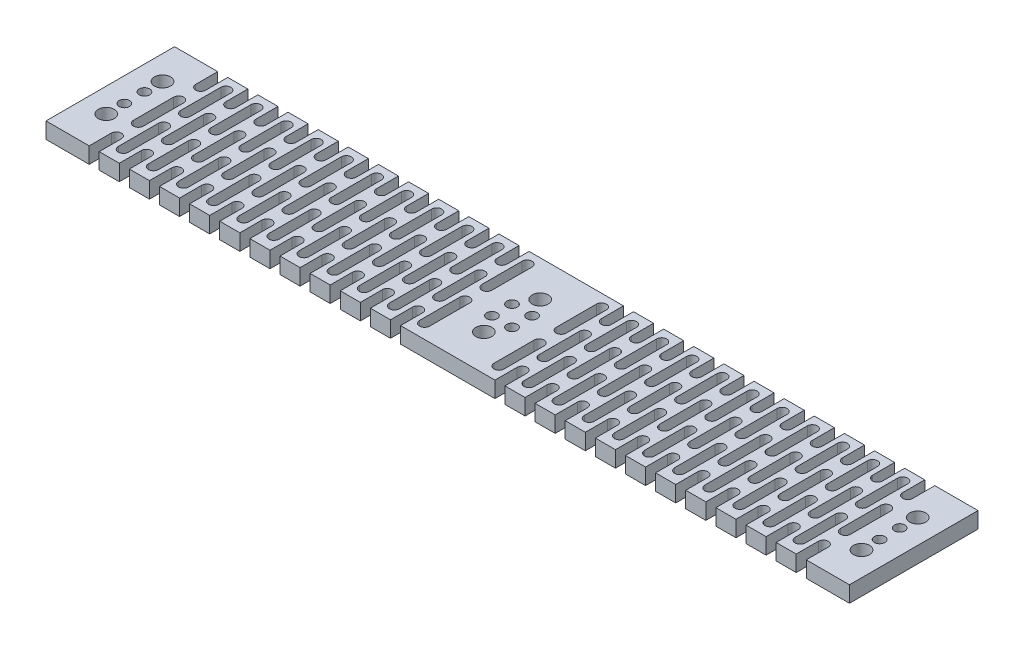
from build123d import *

# Parameters (mm, degrees)
SKETCH_1_W          = 100
SKETCH_1_H          = 16
EXTRUDE_1_DEPTH     = 2
SKETCH_2_R          = 1
SKETCH_2_R_2        = 0.65
CUT_EXTRUDE_1_DEPTH = 51.675437837
CUT_EXTRUDE_2_DEPTH = 51.675437837


with BuildPart() as part:
    # 스케치1 → 보스-돌출1 (new body)
    with BuildSketch(Plane(origin=(0, 0, 0), x_dir=(1, 0, 0), z_dir=(0, 1, 0))):
        Rectangle(SKETCH_1_W, SKETCH_1_H)
    extrude(amount=EXTRUDE_1_DEPTH)

    # 스케치2 → 컷-돌출1 (cut, through all)
    with BuildSketch(Plane(origin=(0, 2, 0), x_dir=(1, 0, 0), z_dir=(0, 1, 0))):
        with Locations((47, 3.5)):
            Circle(SKETCH_2_R)
        with Locations((0, 3.5)):
            Circle(SKETCH_2_R)
        with Locations((-47, 3.5)):
            Circle(SKETCH_2_R)
        with Locations((47, 1.25)):
            Circle(SKETCH_2_R_2)
        with Locations((-47, 1.25)):
            Circle(SKETCH_2_R_2)
        with Locations((1.25, 1.25)):
            Circle(SKETCH_2_R_2)
        with Locations((-1.25, 1.25)):
            Circle(SKETCH_2_R_2)
        with Locations((47, -1.25)):
            Circle(SKETCH_2_R_2)
        with Locations((47, -3.5)):
            Circle(SKETCH_2_R)
        with Locations((-1.25, -1.25)):
            Circle(SKETCH_2_R_2)
        with Locations((1.25, -1.25)):
            Circle(SKETCH_2_R_2)
        with Locations((0, -3.5)):
            Circle(SKETCH_2_R)
        with Locations((-47, -1.25)):
            Circle(SKETCH_2_R_2)
        with Locations((-47, -3.5)):
            Circle(SKETCH_2_R)
    extrude(amount=-CUT_EXTRUDE_1_DEPTH, mode=Mode.SUBTRACT)

    # 스케치3 → 컷-돌출2 (cut, through all)
    with BuildSketch(Plane(origin=(0, 2, 0), x_dir=(1, 0, 0), z_dir=(0, 1, 0))):
        with BuildLine():
            Line((44.625, 2.5), (44.625, -2.5))
            ThreePointArc((44.625, -2.5), (44, -3.125), (43.375, -2.5))
            Line((43.375, -2.5), (43.375, 2.5))
            ThreePointArc((43.375, 2.5), (44, 3.125), (44.625, 2.5))
        make_face()
        with BuildLine():
            Line((40.875, 2.5), (40.875, -2.5))
            ThreePointArc((40.875, -2.5), (40.25, -3.125), (39.625, -2.5))
            Line((39.625, -2.5), (39.625, 2.5))
            ThreePointArc((39.625, 2.5), (40.25, 3.125), (40.875, 2.5))
        make_face()
        with BuildLine():
            Line((37.125, 2.5), (37.125, -2.5))
            ThreePointArc((37.125, -2.5), (36.5, -3.125), (35.875, -2.5))
            Line((35.875, -2.5), (35.875, 2.5))
            ThreePointArc((35.875, 2.5), (36.5, 3.125), (37.125, 2.5))
        make_face()
        with BuildLine():
            Line((33.375, 2.5), (33.375, -2.5))
            ThreePointArc((33.375, -2.5), (32.75, -3.125), (32.125, -2.5))
            Line((32.125, -2.5), (32.125, 2.5))
            ThreePointArc((32.125, 2.5), (32.75, 3.125), (33.375, 2.5))
        make_face()
        with BuildLine():
            Line((29.625, 2.5), (29.625, -2.5))
            ThreePointArc((29.625, -2.5), (29, -3.125), (28.375, -2.5))
            Line((28.375, -2.5), (28.375, 2.5))
            ThreePointArc((28.375, 2.5), (29, 3.125), (29.625, 2.5))
        make_face()
        with BuildLine():
            Line((25.875, 2.5), (25.875, -2.5))
            ThreePointArc((25.875, -2.5), (25.25, -3.125), (24.625, -2.5))
            Line((24.625, -2.5), (24.625, 2.5))
            ThreePointArc((24.625, 2.5), (25.25, 3.125), (25.875, 2.5))
        make_face()
        with BuildLine():
            Line((22.125, 2.5), (22.125, -2.5))
            ThreePointArc((22.125, -2.5), (21.5, -3.125), (20.875, -2.5))
            Line((20.875, -2.5), (20.875, 2.5))
            ThreePointArc((20.875, 2.5), (21.5, 3.125), (22.125, 2.5))
        make_face()
        with BuildLine():
            Line((18.375, 2.5), (18.375, -2.5))
            ThreePointArc((18.375, -2.5), (17.75, -3.125), (17.125, -2.5))
            Line((17.125, -2.5), (17.125, 2.5))
            ThreePointArc((17.125, 2.5), (17.75, 3.125), (18.375, 2.5))
        make_face()
        with BuildLine():
            Line((14.625, 2.5), (14.625, -2.5))
            ThreePointArc((14.625, -2.5), (14, -3.125), (13.375, -2.5))
            Line((13.375, -2.5), (13.375, 2.5))
            ThreePointArc((13.375, 2.5), (14, 3.125), (14.625, 2.5))
        make_face()
        with BuildLine():
            Line((10.875, 2.5), (10.875, -2.5))
            ThreePointArc((10.875, -2.5), (10.25, -3.125), (9.625, -2.5))
            Line((9.625, -2.5), (9.625, 2.5))
            ThreePointArc((9.625, 2.5), (10.25, 3.125), (10.875, 2.5))
        make_face()
        with BuildLine():
            Line((7.125, 2.5), (7.125, -2.5))
            ThreePointArc((7.125, -2.5), (6.5, -3.125), (5.875, -2.5))
            Line((5.875, -2.5), (5.875, 2.5))
            ThreePointArc((5.875, 2.5), (6.5, 3.125), (7.125, 2.5))
        make_face()
        with BuildLine():
            Line((40.875, 10.25), (40.875, 5.25))
            ThreePointArc((40.875, 5.25), (40.25, 4.625), (39.625, 5.25))
            Line((39.625, 5.25), (39.625, 10.25))
            ThreePointArc((39.625, 10.25), (40.25, 10.875), (40.875, 10.25))
        make_face()
        with BuildLine():
            Line((37.125, 10.25), (37.125, 5.25))
            ThreePointArc((37.125, 5.25), (36.5, 4.625), (35.875, 5.25))
            Line((35.875, 5.25), (35.875, 10.25))
            ThreePointArc((35.875, 10.25), (36.5, 10.875), (37.125, 10.25))
        make_face()
        with BuildLine():
            Line((33.375, 10.25), (33.375, 5.25))
            ThreePointArc((33.375, 5.25), (32.75, 4.625), (32.125, 5.25))
            Line((32.125, 5.25), (32.125, 10.25))
            ThreePointArc((32.125, 10.25), (32.75, 10.875), (33.375, 10.25))
        make_face()
        with BuildLine():
            Line((29.625, 10.25), (29.625, 5.25))
            ThreePointArc((29.625, 5.25), (29, 4.625), (28.375, 5.25))
            Line((28.375, 5.25), (28.375, 10.25))
            ThreePointArc((28.375, 10.25), (29, 10.875), (29.625, 10.25))
        make_face()
        with BuildLine():
            Line((25.875, 10.25), (25.875, 5.25))
            ThreePointArc((25.875, 5.25), (25.25, 4.625), (24.625, 5.25))
            Line((24.625, 5.25), (24.625, 10.25))
            ThreePointArc((24.625, 10.25), (25.25, 10.875), (25.875, 10.25))
        make_face()
        with BuildLine():
            Line((22.125, 10.25), (22.125, 5.25))
            ThreePointArc((22.125, 5.25), (21.5, 4.625), (20.875, 5.25))
            Line((20.875, 5.25), (20.875, 10.25))
            ThreePointArc((20.875, 10.25), (21.5, 10.875), (22.125, 10.25))
        make_face()
        with BuildLine():
            Line((18.375, 10.25), (18.375, 5.25))
            ThreePointArc((18.375, 5.25), (17.75, 4.625), (17.125, 5.25))
            Line((17.125, 5.25), (17.125, 10.25))
            ThreePointArc((17.125, 10.25), (17.75, 10.875), (18.375, 10.25))
        make_face()
        with BuildLine():
            Line((14.625, 10.25), (14.625, 5.25))
            ThreePointArc((14.625, 5.25), (14, 4.625), (13.375, 5.25))
            Line((13.375, 5.25), (13.375, 10.25))
            ThreePointArc((13.375, 10.25), (14, 10.875), (14.625, 10.25))
        make_face()
        with BuildLine():
            Line((10.875, 10.25), (10.875, 5.25))
            ThreePointArc((10.875, 5.25), (10.25, 4.625), (9.625, 5.25))
            Line((9.625, 5.25), (9.625, 10.25))
            ThreePointArc((9.625, 10.25), (10.25, 10.875), (10.875, 10.25))
        make_face()
        with BuildLine():
            Line((7.125, 10.25), (7.125, 5.25))
            ThreePointArc((7.125, 5.25), (6.5, 4.625), (5.875, 5.25))
            Line((5.875, 5.25), (5.875, 10.25))
            ThreePointArc((5.875, 10.25), (6.5, 10.875), (7.125, 10.25))
        make_face()
        with BuildLine():
            Line((44.625, 10.25), (44.625, 5.25))
            ThreePointArc((44.625, 5.25), (44, 4.625), (43.375, 5.25))
            Line((43.375, 5.25), (43.375, 10.25))
            ThreePointArc((43.375, 10.25), (44, 10.875), (44.625, 10.25))
        make_face()
        with BuildLine():
            Line((44.625, -10.25), (44.625, -5.25))
            ThreePointArc((44.625, -5.25), (44, -4.625), (43.375, -5.25))
            Line((43.375, -5.25), (43.375, -10.25))
            ThreePointArc((43.375, -10.25), (44, -10.875), (44.625, -10.25))
        make_face()
        with BuildLine():
            Line((7.125, -10.25), (7.125, -5.25))
            ThreePointArc((7.125, -5.25), (6.5, -4.625), (5.875, -5.25))
            Line((5.875, -5.25), (5.875, -10.25))
            ThreePointArc((5.875, -10.25), (6.5, -10.875), (7.125, -10.25))
        make_face()
        with BuildLine():
            Line((10.875, -10.25), (10.875, -5.25))
            ThreePointArc((10.875, -5.25), (10.25, -4.625), (9.625, -5.25))
            Line((9.625, -5.25), (9.625, -10.25))
            ThreePointArc((9.625, -10.25), (10.25, -10.875), (10.875, -10.25))
        make_face()
        with BuildLine():
            Line((14.625, -10.25), (14.625, -5.25))
            ThreePointArc((14.625, -5.25), (14, -4.625), (13.375, -5.25))
            Line((13.375, -5.25), (13.375, -10.25))
            ThreePointArc((13.375, -10.25), (14, -10.875), (14.625, -10.25))
        make_face()
        with BuildLine():
            Line((18.375, -10.25), (18.375, -5.25))
            ThreePointArc((18.375, -5.25), (17.75, -4.625), (17.125, -5.25))
            Line((17.125, -5.25), (17.125, -10.25))
            ThreePointArc((17.125, -10.25), (17.75, -10.875), (18.375, -10.25))
        make_face()
        with BuildLine():
            Line((22.125, -10.25), (22.125, -5.25))
            ThreePointArc((22.125, -5.25), (21.5, -4.625), (20.875, -5.25))
            Line((20.875, -5.25), (20.875, -10.25))
            ThreePointArc((20.875, -10.25), (21.5, -10.875), (22.125, -10.25))
        make_face()
        with BuildLine():
            Line((25.875, -10.25), (25.875, -5.25))
            ThreePointArc((25.875, -5.25), (25.25, -4.625), (24.625, -5.25))
            Line((24.625, -5.25), (24.625, -10.25))
            ThreePointArc((24.625, -10.25), (25.25, -10.875), (25.875, -10.25))
        make_face()
        with BuildLine():
            Line((29.625, -10.25), (29.625, -5.25))
            ThreePointArc((29.625, -5.25), (29, -4.625), (28.375, -5.25))
            Line((28.375, -5.25), (28.375, -10.25))
            ThreePointArc((28.375, -10.25), (29, -10.875), (29.625, -10.25))
        make_face()
        with BuildLine():
            Line((33.375, -10.25), (33.375, -5.25))
            ThreePointArc((33.375, -5.25), (32.75, -4.625), (32.125, -5.25))
            Line((32.125, -5.25), (32.125, -10.25))
            ThreePointArc((32.125, -10.25), (32.75, -10.875), (33.375, -10.25))
        make_face()
        with BuildLine():
            Line((37.125, -10.25), (37.125, -5.25))
            ThreePointArc((37.125, -5.25), (36.5, -4.625), (35.875, -5.25))
            Line((35.875, -5.25), (35.875, -10.25))
            ThreePointArc((35.875, -10.25), (36.5, -10.875), (37.125, -10.25))
        make_face()
        with BuildLine():
            Line((40.875, -10.25), (40.875, -5.25))
            ThreePointArc((40.875, -5.25), (40.25, -4.625), (39.625, -5.25))
            Line((39.625, -5.25), (39.625, -10.25))
            ThreePointArc((39.625, -10.25), (40.25, -10.875), (40.875, -10.25))
        make_face()
        with BuildLine():
            Line((42.75, -1.25), (42.75, -6.25))
            ThreePointArc((42.75, -6.25), (42.125, -6.875), (41.5, -6.25))
            Line((41.5, -6.25), (41.5, -1.25))
            ThreePointArc((41.5, -1.25), (42.125, -0.625), (42.75, -1.25))
        make_face()
        with BuildLine():
            Line((39, -1.25), (39, -6.25))
            ThreePointArc((39, -6.25), (38.375, -6.875), (37.75, -6.25))
            Line((37.75, -6.25), (37.75, -1.25))
            ThreePointArc((37.75, -1.25), (38.375, -0.625), (39, -1.25))
        make_face()
        with BuildLine():
            Line((35.25, -1.25), (35.25, -6.25))
            ThreePointArc((35.25, -6.25), (34.625, -6.875), (34, -6.25))
            Line((34, -6.25), (34, -1.25))
            ThreePointArc((34, -1.25), (34.625, -0.625), (35.25, -1.25))
        make_face()
        with BuildLine():
            Line((31.5, -1.25), (31.5, -6.25))
            ThreePointArc((31.5, -6.25), (30.875, -6.875), (30.25, -6.25))
            Line((30.25, -6.25), (30.25, -1.25))
            ThreePointArc((30.25, -1.25), (30.875, -0.625), (31.5, -1.25))
        make_face()
        with BuildLine():
            Line((27.75, -1.25), (27.75, -6.25))
            ThreePointArc((27.75, -6.25), (27.125, -6.875), (26.5, -6.25))
            Line((26.5, -6.25), (26.5, -1.25))
            ThreePointArc((26.5, -1.25), (27.125, -0.625), (27.75, -1.25))
        make_face()
        with BuildLine():
            Line((24, -1.25), (24, -6.25))
            ThreePointArc((24, -6.25), (23.375, -6.875), (22.75, -6.25))
            Line((22.75, -6.25), (22.75, -1.25))
            ThreePointArc((22.75, -1.25), (23.375, -0.625), (24, -1.25))
        make_face()
        with BuildLine():
            Line((20.25, -1.25), (20.25, -6.25))
            ThreePointArc((20.25, -6.25), (19.625, -6.875), (19, -6.25))
            Line((19, -6.25), (19, -1.25))
            ThreePointArc((19, -1.25), (19.625, -0.625), (20.25, -1.25))
        make_face()
        with BuildLine():
            Line((16.5, -1.25), (16.5, -6.25))
            ThreePointArc((16.5, -6.25), (15.875, -6.875), (15.25, -6.25))
            Line((15.25, -6.25), (15.25, -1.25))
            ThreePointArc((15.25, -1.25), (15.875, -0.625), (16.5, -1.25))
        make_face()
        with BuildLine():
            Line((12.75, -1.25), (12.75, -6.25))
            ThreePointArc((12.75, -6.25), (12.125, -6.875), (11.5, -6.25))
            Line((11.5, -6.25), (11.5, -1.25))
            ThreePointArc((11.5, -1.25), (12.125, -0.625), (12.75, -1.25))
        make_face()
        with BuildLine():
            Line((9, -1.25), (9, -6.25))
            ThreePointArc((9, -6.25), (8.375, -6.875), (7.75, -6.25))
            Line((7.75, -6.25), (7.75, -1.25))
            ThreePointArc((7.75, -1.25), (8.375, -0.625), (9, -1.25))
        make_face()
        with BuildLine():
            Line((5.25, -1.25), (5.25, -6.25))
            ThreePointArc((5.25, -6.25), (4.625, -6.875), (4, -6.25))
            Line((4, -6.25), (4, -1.25))
            ThreePointArc((4, -1.25), (4.625, -0.625), (5.25, -1.25))
        make_face()
        with BuildLine():
            Line((39, 6.5), (39, 1.5))
            ThreePointArc((39, 1.5), (38.375, 0.875), (37.75, 1.5))
            Line((37.75, 1.5), (37.75, 6.5))
            ThreePointArc((37.75, 6.5), (38.375, 7.125), (39, 6.5))
        make_face()
        with BuildLine():
            Line((35.25, 6.5), (35.25, 1.5))
            ThreePointArc((35.25, 1.5), (34.625, 0.875), (34, 1.5))
            Line((34, 1.5), (34, 6.5))
            ThreePointArc((34, 6.5), (34.625, 7.125), (35.25, 6.5))
        make_face()
        with BuildLine():
            Line((31.5, 6.5), (31.5, 1.5))
            ThreePointArc((31.5, 1.5), (30.875, 0.875), (30.25, 1.5))
            Line((30.25, 1.5), (30.25, 6.5))
            ThreePointArc((30.25, 6.5), (30.875, 7.125), (31.5, 6.5))
        make_face()
        with BuildLine():
            Line((27.75, 6.5), (27.75, 1.5))
            ThreePointArc((27.75, 1.5), (27.125, 0.875), (26.5, 1.5))
            Line((26.5, 1.5), (26.5, 6.5))
            ThreePointArc((26.5, 6.5), (27.125, 7.125), (27.75, 6.5))
        make_face()
        with BuildLine():
            Line((24, 6.5), (24, 1.5))
            ThreePointArc((24, 1.5), (23.375, 0.875), (22.75, 1.5))
            Line((22.75, 1.5), (22.75, 6.5))
            ThreePointArc((22.75, 6.5), (23.375, 7.125), (24, 6.5))
        make_face()
        with BuildLine():
            Line((20.25, 6.5), (20.25, 1.5))
            ThreePointArc((20.25, 1.5), (19.625, 0.875), (19, 1.5))
            Line((19, 1.5), (19, 6.5))
            ThreePointArc((19, 6.5), (19.625, 7.125), (20.25, 6.5))
        make_face()
        with BuildLine():
            Line((16.5, 6.5), (16.5, 1.5))
            ThreePointArc((16.5, 1.5), (15.875, 0.875), (15.25, 1.5))
            Line((15.25, 1.5), (15.25, 6.5))
            ThreePointArc((15.25, 6.5), (15.875, 7.125), (16.5, 6.5))
        make_face()
        with BuildLine():
            Line((12.75, 6.5), (12.75, 1.5))
            ThreePointArc((12.75, 1.5), (12.125, 0.875), (11.5, 1.5))
            Line((11.5, 1.5), (11.5, 6.5))
            ThreePointArc((11.5, 6.5), (12.125, 7.125), (12.75, 6.5))
        make_face()
        with BuildLine():
            Line((9, 6.5), (9, 1.5))
            ThreePointArc((9, 1.5), (8.375, 0.875), (7.75, 1.5))
            Line((7.75, 1.5), (7.75, 6.5))
            ThreePointArc((7.75, 6.5), (8.375, 7.125), (9, 6.5))
        make_face()
        with BuildLine():
            Line((5.25, 6.5), (5.25, 1.5))
            ThreePointArc((5.25, 1.5), (4.625, 0.875), (4, 1.5))
            Line((4, 1.5), (4, 6.5))
            ThreePointArc((4, 6.5), (4.625, 7.125), (5.25, 6.5))
        make_face()
        with BuildLine():
            Line((42.75, 6.5), (42.75, 1.5))
            ThreePointArc((42.75, 1.5), (42.125, 0.875), (41.5, 1.5))
            Line((41.5, 1.5), (41.5, 6.5))
            ThreePointArc((41.5, 6.5), (42.125, 7.125), (42.75, 6.5))
        make_face()
        with BuildLine():
            Line((-42.75, 6.5), (-42.75, 1.5))
            ThreePointArc((-42.75, 1.5), (-42.125, 0.875), (-41.5, 1.5))
            Line((-41.5, 1.5), (-41.5, 6.5))
            ThreePointArc((-41.5, 6.5), (-42.125, 7.125), (-42.75, 6.5))
        make_face()
        with BuildLine():
            Line((-5.25, 6.5), (-5.25, 1.5))
            ThreePointArc((-5.25, 1.5), (-4.625, 0.875), (-4, 1.5))
            Line((-4, 1.5), (-4, 6.5))
            ThreePointArc((-4, 6.5), (-4.625, 7.125), (-5.25, 6.5))
        make_face()
        with BuildLine():
            Line((-9, 6.5), (-9, 1.5))
            ThreePointArc((-9, 1.5), (-8.375, 0.875), (-7.75, 1.5))
            Line((-7.75, 1.5), (-7.75, 6.5))
            ThreePointArc((-7.75, 6.5), (-8.375, 7.125), (-9, 6.5))
        make_face()
        with BuildLine():
            Line((-12.75, 6.5), (-12.75, 1.5))
            ThreePointArc((-12.75, 1.5), (-12.125, 0.875), (-11.5, 1.5))
            Line((-11.5, 1.5), (-11.5, 6.5))
            ThreePointArc((-11.5, 6.5), (-12.125, 7.125), (-12.75, 6.5))
        make_face()
        with BuildLine():
            Line((-16.5, 6.5), (-16.5, 1.5))
            ThreePointArc((-16.5, 1.5), (-15.875, 0.875), (-15.25, 1.5))
            Line((-15.25, 1.5), (-15.25, 6.5))
            ThreePointArc((-15.25, 6.5), (-15.875, 7.125), (-16.5, 6.5))
        make_face()
        with BuildLine():
            Line((-20.25, 6.5), (-20.25, 1.5))
            ThreePointArc((-20.25, 1.5), (-19.625, 0.875), (-19, 1.5))
            Line((-19, 1.5), (-19, 6.5))
            ThreePointArc((-19, 6.5), (-19.625, 7.125), (-20.25, 6.5))
        make_face()
        with BuildLine():
            Line((-24, 6.5), (-24, 1.5))
            ThreePointArc((-24, 1.5), (-23.375, 0.875), (-22.75, 1.5))
            Line((-22.75, 1.5), (-22.75, 6.5))
            ThreePointArc((-22.75, 6.5), (-23.375, 7.125), (-24, 6.5))
        make_face()
        with BuildLine():
            Line((-27.75, 6.5), (-27.75, 1.5))
            ThreePointArc((-27.75, 1.5), (-27.125, 0.875), (-26.5, 1.5))
            Line((-26.5, 1.5), (-26.5, 6.5))
            ThreePointArc((-26.5, 6.5), (-27.125, 7.125), (-27.75, 6.5))
        make_face()
        with BuildLine():
            Line((-31.5, 6.5), (-31.5, 1.5))
            ThreePointArc((-31.5, 1.5), (-30.875, 0.875), (-30.25, 1.5))
            Line((-30.25, 1.5), (-30.25, 6.5))
            ThreePointArc((-30.25, 6.5), (-30.875, 7.125), (-31.5, 6.5))
        make_face()
        with BuildLine():
            Line((-35.25, 6.5), (-35.25, 1.5))
            ThreePointArc((-35.25, 1.5), (-34.625, 0.875), (-34, 1.5))
            Line((-34, 1.5), (-34, 6.5))
            ThreePointArc((-34, 6.5), (-34.625, 7.125), (-35.25, 6.5))
        make_face()
        with BuildLine():
            Line((-39, 6.5), (-39, 1.5))
            ThreePointArc((-39, 1.5), (-38.375, 0.875), (-37.75, 1.5))
            Line((-37.75, 1.5), (-37.75, 6.5))
            ThreePointArc((-37.75, 6.5), (-38.375, 7.125), (-39, 6.5))
        make_face()
        with BuildLine():
            Line((-5.25, -1.25), (-5.25, -6.25))
            ThreePointArc((-5.25, -6.25), (-4.625, -6.875), (-4, -6.25))
            Line((-4, -6.25), (-4, -1.25))
            ThreePointArc((-4, -1.25), (-4.625, -0.625), (-5.25, -1.25))
        make_face()
        with BuildLine():
            Line((-9, -1.25), (-9, -6.25))
            ThreePointArc((-9, -6.25), (-8.375, -6.875), (-7.75, -6.25))
            Line((-7.75, -6.25), (-7.75, -1.25))
            ThreePointArc((-7.75, -1.25), (-8.375, -0.625), (-9, -1.25))
        make_face()
        with BuildLine():
            Line((-12.75, -1.25), (-12.75, -6.25))
            ThreePointArc((-12.75, -6.25), (-12.125, -6.875), (-11.5, -6.25))
            Line((-11.5, -6.25), (-11.5, -1.25))
            ThreePointArc((-11.5, -1.25), (-12.125, -0.625), (-12.75, -1.25))
        make_face()
        with BuildLine():
            Line((-16.5, -1.25), (-16.5, -6.25))
            ThreePointArc((-16.5, -6.25), (-15.875, -6.875), (-15.25, -6.25))
            Line((-15.25, -6.25), (-15.25, -1.25))
            ThreePointArc((-15.25, -1.25), (-15.875, -0.625), (-16.5, -1.25))
        make_face()
        with BuildLine():
            Line((-20.25, -1.25), (-20.25, -6.25))
            ThreePointArc((-20.25, -6.25), (-19.625, -6.875), (-19, -6.25))
            Line((-19, -6.25), (-19, -1.25))
            ThreePointArc((-19, -1.25), (-19.625, -0.625), (-20.25, -1.25))
        make_face()
        with BuildLine():
            Line((-24, -1.25), (-24, -6.25))
            ThreePointArc((-24, -6.25), (-23.375, -6.875), (-22.75, -6.25))
            Line((-22.75, -6.25), (-22.75, -1.25))
            ThreePointArc((-22.75, -1.25), (-23.375, -0.625), (-24, -1.25))
        make_face()
        with BuildLine():
            Line((-27.75, -1.25), (-27.75, -6.25))
            ThreePointArc((-27.75, -6.25), (-27.125, -6.875), (-26.5, -6.25))
            Line((-26.5, -6.25), (-26.5, -1.25))
            ThreePointArc((-26.5, -1.25), (-27.125, -0.625), (-27.75, -1.25))
        make_face()
        with BuildLine():
            Line((-31.5, -1.25), (-31.5, -6.25))
            ThreePointArc((-31.5, -6.25), (-30.875, -6.875), (-30.25, -6.25))
            Line((-30.25, -6.25), (-30.25, -1.25))
            ThreePointArc((-30.25, -1.25), (-30.875, -0.625), (-31.5, -1.25))
        make_face()
        with BuildLine():
            Line((-35.25, -1.25), (-35.25, -6.25))
            ThreePointArc((-35.25, -6.25), (-34.625, -6.875), (-34, -6.25))
            Line((-34, -6.25), (-34, -1.25))
            ThreePointArc((-34, -1.25), (-34.625, -0.625), (-35.25, -1.25))
        make_face()
        with BuildLine():
            Line((-39, -1.25), (-39, -6.25))
            ThreePointArc((-39, -6.25), (-38.375, -6.875), (-37.75, -6.25))
            Line((-37.75, -6.25), (-37.75, -1.25))
            ThreePointArc((-37.75, -1.25), (-38.375, -0.625), (-39, -1.25))
        make_face()
        with BuildLine():
            Line((-42.75, -1.25), (-42.75, -6.25))
            ThreePointArc((-42.75, -6.25), (-42.125, -6.875), (-41.5, -6.25))
            Line((-41.5, -6.25), (-41.5, -1.25))
            ThreePointArc((-41.5, -1.25), (-42.125, -0.625), (-42.75, -1.25))
        make_face()
        with BuildLine():
            Line((-40.875, -10.25), (-40.875, -5.25))
            ThreePointArc((-40.875, -5.25), (-40.25, -4.625), (-39.625, -5.25))
            Line((-39.625, -5.25), (-39.625, -10.25))
            ThreePointArc((-39.625, -10.25), (-40.25, -10.875), (-40.875, -10.25))
        make_face()
        with BuildLine():
            Line((-37.125, -10.25), (-37.125, -5.25))
            ThreePointArc((-37.125, -5.25), (-36.5, -4.625), (-35.875, -5.25))
            Line((-35.875, -5.25), (-35.875, -10.25))
            ThreePointArc((-35.875, -10.25), (-36.5, -10.875), (-37.125, -10.25))
        make_face()
        with BuildLine():
            Line((-33.375, -10.25), (-33.375, -5.25))
            ThreePointArc((-33.375, -5.25), (-32.75, -4.625), (-32.125, -5.25))
            Line((-32.125, -5.25), (-32.125, -10.25))
            ThreePointArc((-32.125, -10.25), (-32.75, -10.875), (-33.375, -10.25))
        make_face()
        with BuildLine():
            Line((-29.625, -10.25), (-29.625, -5.25))
            ThreePointArc((-29.625, -5.25), (-29, -4.625), (-28.375, -5.25))
            Line((-28.375, -5.25), (-28.375, -10.25))
            ThreePointArc((-28.375, -10.25), (-29, -10.875), (-29.625, -10.25))
        make_face()
        with BuildLine():
            Line((-25.875, -10.25), (-25.875, -5.25))
            ThreePointArc((-25.875, -5.25), (-25.25, -4.625), (-24.625, -5.25))
            Line((-24.625, -5.25), (-24.625, -10.25))
            ThreePointArc((-24.625, -10.25), (-25.25, -10.875), (-25.875, -10.25))
        make_face()
        with BuildLine():
            Line((-22.125, -10.25), (-22.125, -5.25))
            ThreePointArc((-22.125, -5.25), (-21.5, -4.625), (-20.875, -5.25))
            Line((-20.875, -5.25), (-20.875, -10.25))
            ThreePointArc((-20.875, -10.25), (-21.5, -10.875), (-22.125, -10.25))
        make_face()
        with BuildLine():
            Line((-18.375, -10.25), (-18.375, -5.25))
            ThreePointArc((-18.375, -5.25), (-17.75, -4.625), (-17.125, -5.25))
            Line((-17.125, -5.25), (-17.125, -10.25))
            ThreePointArc((-17.125, -10.25), (-17.75, -10.875), (-18.375, -10.25))
        make_face()
        with BuildLine():
            Line((-14.625, -10.25), (-14.625, -5.25))
            ThreePointArc((-14.625, -5.25), (-14, -4.625), (-13.375, -5.25))
            Line((-13.375, -5.25), (-13.375, -10.25))
            ThreePointArc((-13.375, -10.25), (-14, -10.875), (-14.625, -10.25))
        make_face()
        with BuildLine():
            Line((-10.875, -10.25), (-10.875, -5.25))
            ThreePointArc((-10.875, -5.25), (-10.25, -4.625), (-9.625, -5.25))
            Line((-9.625, -5.25), (-9.625, -10.25))
            ThreePointArc((-9.625, -10.25), (-10.25, -10.875), (-10.875, -10.25))
        make_face()
        with BuildLine():
            Line((-7.125, -10.25), (-7.125, -5.25))
            ThreePointArc((-7.125, -5.25), (-6.5, -4.625), (-5.875, -5.25))
            Line((-5.875, -5.25), (-5.875, -10.25))
            ThreePointArc((-5.875, -10.25), (-6.5, -10.875), (-7.125, -10.25))
        make_face()
        with BuildLine():
            Line((-44.625, -10.25), (-44.625, -5.25))
            ThreePointArc((-44.625, -5.25), (-44, -4.625), (-43.375, -5.25))
            Line((-43.375, -5.25), (-43.375, -10.25))
            ThreePointArc((-43.375, -10.25), (-44, -10.875), (-44.625, -10.25))
        make_face()
        with BuildLine():
            Line((-44.625, 10.25), (-44.625, 5.25))
            ThreePointArc((-44.625, 5.25), (-44, 4.625), (-43.375, 5.25))
            Line((-43.375, 5.25), (-43.375, 10.25))
            ThreePointArc((-43.375, 10.25), (-44, 10.875), (-44.625, 10.25))
        make_face()
        with BuildLine():
            Line((-7.125, 10.25), (-7.125, 5.25))
            ThreePointArc((-7.125, 5.25), (-6.5, 4.625), (-5.875, 5.25))
            Line((-5.875, 5.25), (-5.875, 10.25))
            ThreePointArc((-5.875, 10.25), (-6.5, 10.875), (-7.125, 10.25))
        make_face()
        with BuildLine():
            Line((-10.875, 10.25), (-10.875, 5.25))
            ThreePointArc((-10.875, 5.25), (-10.25, 4.625), (-9.625, 5.25))
            Line((-9.625, 5.25), (-9.625, 10.25))
            ThreePointArc((-9.625, 10.25), (-10.25, 10.875), (-10.875, 10.25))
        make_face()
        with BuildLine():
            Line((-14.625, 10.25), (-14.625, 5.25))
            ThreePointArc((-14.625, 5.25), (-14, 4.625), (-13.375, 5.25))
            Line((-13.375, 5.25), (-13.375, 10.25))
            ThreePointArc((-13.375, 10.25), (-14, 10.875), (-14.625, 10.25))
        make_face()
        with BuildLine():
            Line((-18.375, 10.25), (-18.375, 5.25))
            ThreePointArc((-18.375, 5.25), (-17.75, 4.625), (-17.125, 5.25))
            Line((-17.125, 5.25), (-17.125, 10.25))
            ThreePointArc((-17.125, 10.25), (-17.75, 10.875), (-18.375, 10.25))
        make_face()
        with BuildLine():
            Line((-22.125, 10.25), (-22.125, 5.25))
            ThreePointArc((-22.125, 5.25), (-21.5, 4.625), (-20.875, 5.25))
            Line((-20.875, 5.25), (-20.875, 10.25))
            ThreePointArc((-20.875, 10.25), (-21.5, 10.875), (-22.125, 10.25))
        make_face()
        with BuildLine():
            Line((-25.875, 10.25), (-25.875, 5.25))
            ThreePointArc((-25.875, 5.25), (-25.25, 4.625), (-24.625, 5.25))
            Line((-24.625, 5.25), (-24.625, 10.25))
            ThreePointArc((-24.625, 10.25), (-25.25, 10.875), (-25.875, 10.25))
        make_face()
        with BuildLine():
            Line((-29.625, 10.25), (-29.625, 5.25))
            ThreePointArc((-29.625, 5.25), (-29, 4.625), (-28.375, 5.25))
            Line((-28.375, 5.25), (-28.375, 10.25))
            ThreePointArc((-28.375, 10.25), (-29, 10.875), (-29.625, 10.25))
        make_face()
        with BuildLine():
            Line((-33.375, 10.25), (-33.375, 5.25))
            ThreePointArc((-33.375, 5.25), (-32.75, 4.625), (-32.125, 5.25))
            Line((-32.125, 5.25), (-32.125, 10.25))
            ThreePointArc((-32.125, 10.25), (-32.75, 10.875), (-33.375, 10.25))
        make_face()
        with BuildLine():
            Line((-37.125, 10.25), (-37.125, 5.25))
            ThreePointArc((-37.125, 5.25), (-36.5, 4.625), (-35.875, 5.25))
            Line((-35.875, 5.25), (-35.875, 10.25))
            ThreePointArc((-35.875, 10.25), (-36.5, 10.875), (-37.125, 10.25))
        make_face()
        with BuildLine():
            Line((-40.875, 10.25), (-40.875, 5.25))
            ThreePointArc((-40.875, 5.25), (-40.25, 4.625), (-39.625, 5.25))
            Line((-39.625, 5.25), (-39.625, 10.25))
            ThreePointArc((-39.625, 10.25), (-40.25, 10.875), (-40.875, 10.25))
        make_face()
        with BuildLine():
            Line((-7.125, 2.5), (-7.125, -2.5))
            ThreePointArc((-7.125, -2.5), (-6.5, -3.125), (-5.875, -2.5))
            Line((-5.875, -2.5), (-5.875, 2.5))
            ThreePointArc((-5.875, 2.5), (-6.5, 3.125), (-7.125, 2.5))
        make_face()
        with BuildLine():
            Line((-10.875, 2.5), (-10.875, -2.5))
            ThreePointArc((-10.875, -2.5), (-10.25, -3.125), (-9.625, -2.5))
            Line((-9.625, -2.5), (-9.625, 2.5))
            ThreePointArc((-9.625, 2.5), (-10.25, 3.125), (-10.875, 2.5))
        make_face()
        with BuildLine():
            Line((-14.625, 2.5), (-14.625, -2.5))
            ThreePointArc((-14.625, -2.5), (-14, -3.125), (-13.375, -2.5))
            Line((-13.375, -2.5), (-13.375, 2.5))
            ThreePointArc((-13.375, 2.5), (-14, 3.125), (-14.625, 2.5))
        make_face()
        with BuildLine():
            Line((-18.375, 2.5), (-18.375, -2.5))
            ThreePointArc((-18.375, -2.5), (-17.75, -3.125), (-17.125, -2.5))
            Line((-17.125, -2.5), (-17.125, 2.5))
            ThreePointArc((-17.125, 2.5), (-17.75, 3.125), (-18.375, 2.5))
        make_face()
        with BuildLine():
            Line((-22.125, 2.5), (-22.125, -2.5))
            ThreePointArc((-22.125, -2.5), (-21.5, -3.125), (-20.875, -2.5))
            Line((-20.875, -2.5), (-20.875, 2.5))
            ThreePointArc((-20.875, 2.5), (-21.5, 3.125), (-22.125, 2.5))
        make_face()
        with BuildLine():
            Line((-25.875, 2.5), (-25.875, -2.5))
            ThreePointArc((-25.875, -2.5), (-25.25, -3.125), (-24.625, -2.5))
            Line((-24.625, -2.5), (-24.625, 2.5))
            ThreePointArc((-24.625, 2.5), (-25.25, 3.125), (-25.875, 2.5))
        make_face()
        with BuildLine():
            Line((-29.625, 2.5), (-29.625, -2.5))
            ThreePointArc((-29.625, -2.5), (-29, -3.125), (-28.375, -2.5))
            Line((-28.375, -2.5), (-28.375, 2.5))
            ThreePointArc((-28.375, 2.5), (-29, 3.125), (-29.625, 2.5))
        make_face()
        with BuildLine():
            Line((-33.375, 2.5), (-33.375, -2.5))
            ThreePointArc((-33.375, -2.5), (-32.75, -3.125), (-32.125, -2.5))
            Line((-32.125, -2.5), (-32.125, 2.5))
            ThreePointArc((-32.125, 2.5), (-32.75, 3.125), (-33.375, 2.5))
        make_face()
        with BuildLine():
            Line((-37.125, 2.5), (-37.125, -2.5))
            ThreePointArc((-37.125, -2.5), (-36.5, -3.125), (-35.875, -2.5))
            Line((-35.875, -2.5), (-35.875, 2.5))
            ThreePointArc((-35.875, 2.5), (-36.5, 3.125), (-37.125, 2.5))
        make_face()
        with BuildLine():
            Line((-40.875, 2.5), (-40.875, -2.5))
            ThreePointArc((-40.875, -2.5), (-40.25, -3.125), (-39.625, -2.5))
            Line((-39.625, -2.5), (-39.625, 2.5))
            ThreePointArc((-39.625, 2.5), (-40.25, 3.125), (-40.875, 2.5))
        make_face()
        with BuildLine():
            Line((-44.625, 2.5), (-44.625, -2.5))
            ThreePointArc((-44.625, -2.5), (-44, -3.125), (-43.375, -2.5))
            Line((-43.375, -2.5), (-43.375, 2.5))
            ThreePointArc((-43.375, 2.5), (-44, 3.125), (-44.625, 2.5))
        make_face()
    extrude(amount=-CUT_EXTRUDE_2_DEPTH, mode=Mode.SUBTRACT)


solid = part.part
